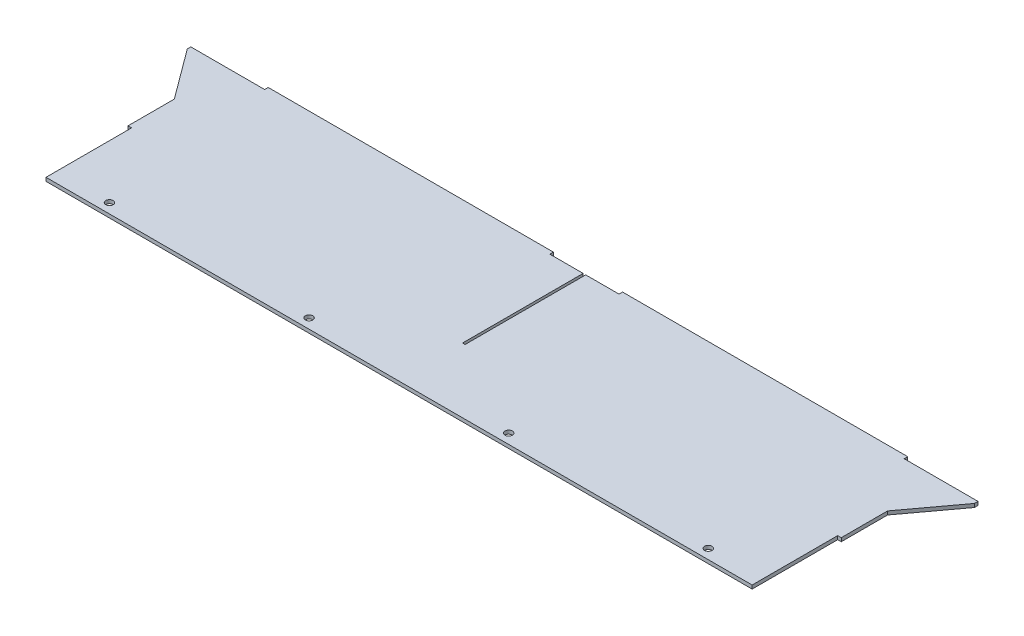
from build123d import *

# Parameters (mm, degrees)
SKETCH1_W            = 635.3556
SKETCH1_H            = 165.1
BOSS_EXTRUDE1_DEPTH  = 1.5875
SKETCH2_W            = 254
SKETCH2_H            = 3.175
BOSS_EXTRUDE2_DEPTH  = 3.175
BOSS_EXTRUDE3_DEPTH  = 3.175
SKETCH5_W            = 3.175
SKETCH5_H            = 76.2
SKETCH5_W_2          = 2.286
SKETCH5_H_2          = 107.442
CUT_EXTRUDE2_DEPTH   = 361.921161502
M6_CLEARANCE_HOLE1_D = 6.6
LPATTERN2_COUNT      = 4
LPATTERN2_PITCH      = 177.8


with BuildPart() as part:
    # Sketch1 → Boss-Extrude1 (new, symmetric)
    with BuildSketch(Plane(origin=(0, 0, 0), x_dir=(1, 0, 0), z_dir=(0, 1, 0))):
        Rectangle(SKETCH1_W, SKETCH1_H)
    extrude(amount=BOSS_EXTRUDE1_DEPTH, both=True)

    # Sketch2 → Boss-Extrude2 (add)
    with BuildSketch(Plane(origin=(0, 0, -82.55), x_dir=(-1, 0, 0), z_dir=(0, 0, -1))):
        with Locations((-157.8229, 0)):
            Rectangle(SKETCH2_W, SKETCH2_H)
        with Locations((157.8229, 0)):
            Rectangle(SKETCH2_W, SKETCH2_H)
    extrude(amount=BOSS_EXTRUDE2_DEPTH)

    # Sketch3 → Boss-Extrude3 (add)
    with BuildSketch(Plane.XZ.offset(1.5875)):
        Polygon((317.6778, -82.55), (350.57842, -82.55), (350.57842, -79.375), (317.6778, -34.925), align=None)
    boss_extrude3 = extrude(amount=-BOSS_EXTRUDE3_DEPTH)

    # Mirror1: Boss-Extrude3 across plane
    add(boss_extrude3.mirror(Plane(origin=(0, 0, 0), x_dir=(0, 0, 1), z_dir=(1, 0, 0))))

    # Sketch5 → Cut-Extrude2 (cut, through all)
    with BuildSketch(Plane.XZ.offset(1.5875)):
        with Locations((316.0903, 44.45)):
            Rectangle(SKETCH5_W, SKETCH5_H)
        with Locations((0, -28.829)):
            Rectangle(SKETCH5_W_2, SKETCH5_H_2)
        with Locations((-316.0903, 44.45)):
            Rectangle(SKETCH5_W, SKETCH5_H)
    extrude(amount=-CUT_EXTRUDE2_DEPTH, mode=Mode.SUBTRACT)

    # M6 Clearance Hole1 (through all)
    with Locations(Plane(origin=(0, 1.5875, 0), x_dir=(1, 0, 0), z_dir=(0, 1, 0))):
        with Locations((266.7, -73.8124)):
            m6_clearance_hole1 = Hole(M6_CLEARANCE_HOLE1_D / 2)

    # LPattern2: M6 Clearance Hole1 ×4
    with Locations(*[(-i * LPATTERN2_PITCH, 0, 0) for i in range(1, LPATTERN2_COUNT)]):
        add(m6_clearance_hole1, mode=Mode.SUBTRACT)


solid = part.part
